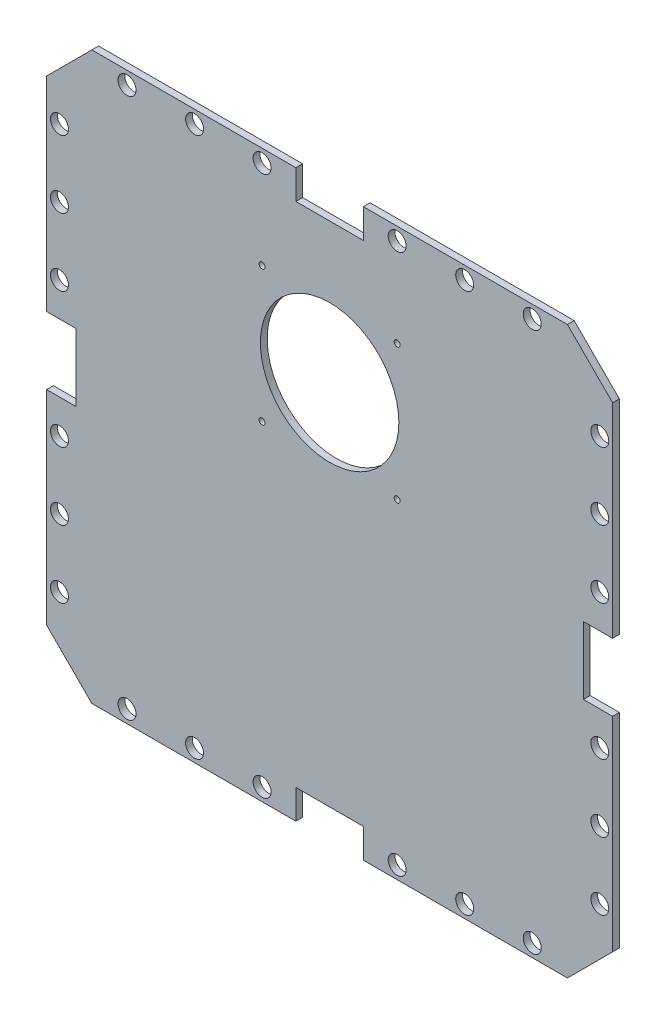
from build123d import *

# Parameters (mm, degrees)
SKETCH1_R             = 3.379999993
SKETCH1_R_2           = 3.379999996
SKETCH1_R_3           = 3.379999998
SKETCH1_R_4           = 1.13
SKETCH1_R_5           = 3.38
SKETCH1_R_6           = 26.035
BOSS_EXTRUDE1_DEPTH   = 2.54
F_4_40_TAPPED_HOLE1_D = 2.2606


with BuildPart() as part:
    # Sketch1 → Boss-Extrude1 (new body)
    with BuildSketch(Plane.XY):
        Polygon((93.726, 0), (16.997849999, 0), (0, -16.997849999), (0, -93.726000007), (11, -93.726000007), (11, -119.126000007), (0, -119.126000007), (0, -195.854150007), (16.997849999, -212.852000007), (93.726000007, -212.852000007), (93.726000007, -201.852000007), (119.126000007, -201.852000007), (119.126000007, -212.852000007), (195.854150007, -212.852000007), (212.852000007, -195.854150007), (212.852000007, -119.126), (201.852000007, -119.126), (201.852000007, -93.726), (212.852000007, -93.726), (212.852000007, -16.997849999), (195.854150007, 0), (119.126, 0), (119.126, -11), (93.726, -11), align=None)
        with Locations((30.226, -208.026000005)):
            Circle(SKETCH1_R, mode=Mode.SUBTRACT)
        with Locations((4.825999998, -182.626000003)):
            Circle(SKETCH1_R_2, mode=Mode.SUBTRACT)
        with Locations((55.626, -208.026000005)):
            Circle(SKETCH1_R, mode=Mode.SUBTRACT)
        with Locations((81.026, -208.026000005)):
            Circle(SKETCH1_R, mode=Mode.SUBTRACT)
        with Locations((4.825999998, -157.226000003)):
            Circle(SKETCH1_R_2, mode=Mode.SUBTRACT)
        with Locations((4.825999998, -131.826000003)):
            Circle(SKETCH1_R_2, mode=Mode.SUBTRACT)
        with Locations((131.826, -208.026000005)):
            Circle(SKETCH1_R, mode=Mode.SUBTRACT)
        with Locations((157.226, -208.026000005)):
            Circle(SKETCH1_R, mode=Mode.SUBTRACT)
        with Locations((182.626, -208.026000005)):
            Circle(SKETCH1_R, mode=Mode.SUBTRACT)
        with Locations((208.026000002, -182.626000003)):
            Circle(SKETCH1_R_3, mode=Mode.SUBTRACT)
        with Locations((208.026000002, -157.226000003)):
            Circle(SKETCH1_R_3, mode=Mode.SUBTRACT)
        with Locations((208.026000002, -131.826000003)):
            Circle(SKETCH1_R_3, mode=Mode.SUBTRACT)
        with Locations((4.825999998, -81.026000003)):
            Circle(SKETCH1_R_2, mode=Mode.SUBTRACT)
        with Locations((4.825999998, -55.626000003)):
            Circle(SKETCH1_R_2, mode=Mode.SUBTRACT)
        with Locations((81.026000003, -89.00415)):
            Circle(SKETCH1_R_4, mode=Mode.SUBTRACT)
        with Locations((4.825999998, -30.226000003)):
            Circle(SKETCH1_R_2, mode=Mode.SUBTRACT)
        with Locations((30.226, -4.826000001)):
            Circle(SKETCH1_R_5, mode=Mode.SUBTRACT)
        with Locations((81.026000003, -38.20415)):
            Circle(SKETCH1_R_4, mode=Mode.SUBTRACT)
        with Locations((55.626, -4.826000001)):
            Circle(SKETCH1_R_5, mode=Mode.SUBTRACT)
        with Locations((81.026, -4.826000001)):
            Circle(SKETCH1_R_5, mode=Mode.SUBTRACT)
        with Locations((131.826000003, -89.00415)):
            Circle(SKETCH1_R_4, mode=Mode.SUBTRACT)
        with Locations((106.426000003, -63.60415)):
            Circle(SKETCH1_R_6, mode=Mode.SUBTRACT)
        with Locations((208.026000002, -81.026000003)):
            Circle(SKETCH1_R_3, mode=Mode.SUBTRACT)
        with Locations((208.026000002, -55.626000003)):
            Circle(SKETCH1_R_3, mode=Mode.SUBTRACT)
        with Locations((131.826000003, -38.20415)):
            Circle(SKETCH1_R_4, mode=Mode.SUBTRACT)
        with Locations((131.826, -4.826000001)):
            Circle(SKETCH1_R_5, mode=Mode.SUBTRACT)
        with Locations((157.226, -4.826000001)):
            Circle(SKETCH1_R_5, mode=Mode.SUBTRACT)
        with Locations((208.026000002, -30.226000003)):
            Circle(SKETCH1_R_3, mode=Mode.SUBTRACT)
        with Locations((182.626, -4.826000001)):
            Circle(SKETCH1_R_5, mode=Mode.SUBTRACT)
    extrude(amount=BOSS_EXTRUDE1_DEPTH)

    # #4-40 Tapped Hole1 (through all)
    with Locations(Plane(origin=(81.026000003, -38.20415, 2.54), x_dir=(1, 0, 0), z_dir=(0, 0, 1))):
        with Locations((0, 0), (50.8, 0), (50.8, -50.8), (0, -50.8)):
            Hole(F_4_40_TAPPED_HOLE1_D / 2)


solid = part.part
